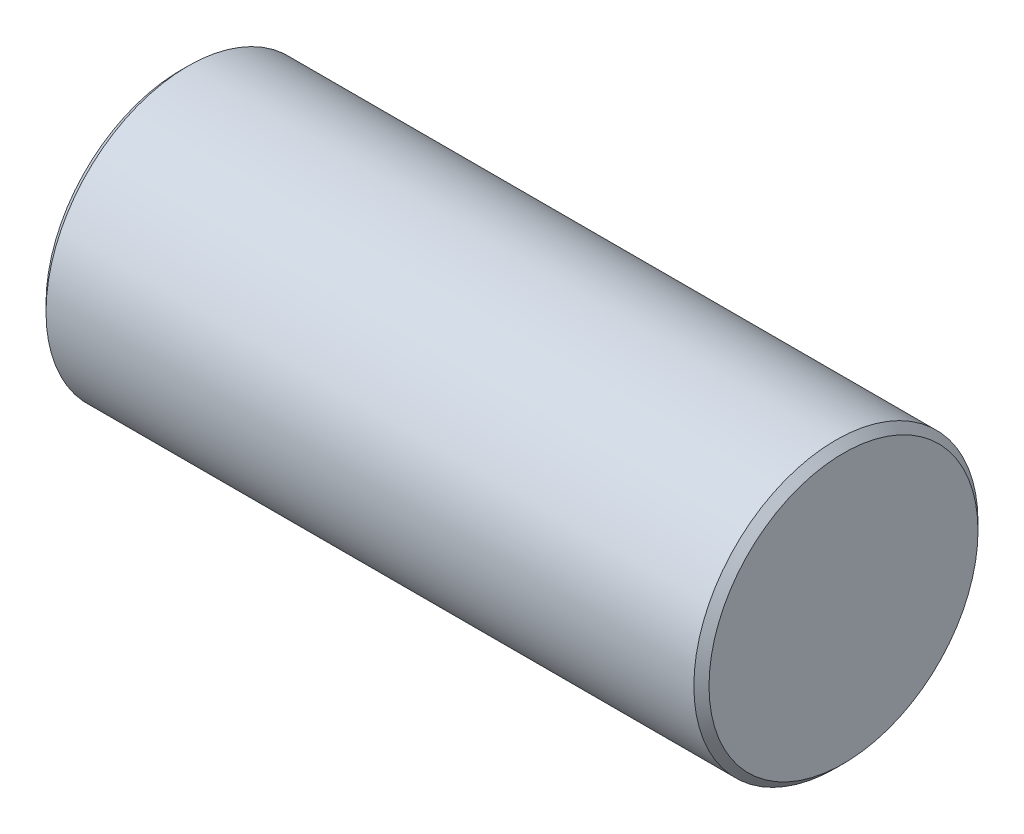
from build123d import *

# Parameters (mm, degrees)
SKETCH1_R                 = 4.7625
BOSS_EXTRUDE1_DEPTH       = 11.1125
SKETCH2_W                 = 8.255
SKETCH2_H                 = 9.525
CUT_EXTRUDE1_DEPTH        = 0.508
F_4_40_TAPPED_HOLE1_D     = 2.2606
F_4_40_TAPPED_HOLE1_DEPTH = 3.81
F_4_40_TAPPED_HOLE1_TIP   = 0.679152758
CHAMFER1_SIZE             = 0.254


with BuildPart() as part:
    # Sketch1 → Boss-Extrude1 (new, symmetric)
    with BuildSketch(Plane(origin=(0, 0, 0), x_dir=(0, 0, -1), z_dir=(1, 0, 0))):
        Circle(SKETCH1_R)
    extrude(amount=BOSS_EXTRUDE1_DEPTH, both=True)

    # Sketch2 → Cut-Extrude1 (cut)
    with BuildSketch(Plane(origin=(0, 0, -4.7625), x_dir=(-1, 0, 0), z_dir=(0, 0, -1))):
        Rectangle(SKETCH2_W, SKETCH2_H)
    extrude(amount=-CUT_EXTRUDE1_DEPTH, mode=Mode.SUBTRACT)

    # #4-40 Tapped Hole1
    with Locations(Plane(origin=(0, 0, -4.2545), x_dir=(-1, 0, 0), z_dir=(0, 0, -1))):
        with Locations((0, 0)):
            Hole(F_4_40_TAPPED_HOLE1_D / 2, depth=F_4_40_TAPPED_HOLE1_DEPTH)
            with Locations((0, 0, -(F_4_40_TAPPED_HOLE1_DEPTH + F_4_40_TAPPED_HOLE1_TIP / 2))):  # 118° drill point
                Cone(0, F_4_40_TAPPED_HOLE1_D / 2, F_4_40_TAPPED_HOLE1_TIP, mode=Mode.SUBTRACT)

    # Chamfer1
    chamfer1_edges = [part.edges().sort_by_distance(p)[0] for p in [
        (-11.1125, 0, 4.7625),
        (11.1125, 0, 4.7625),
    ]]
    chamfer(chamfer1_edges, length=CHAMFER1_SIZE)


solid = part.part
